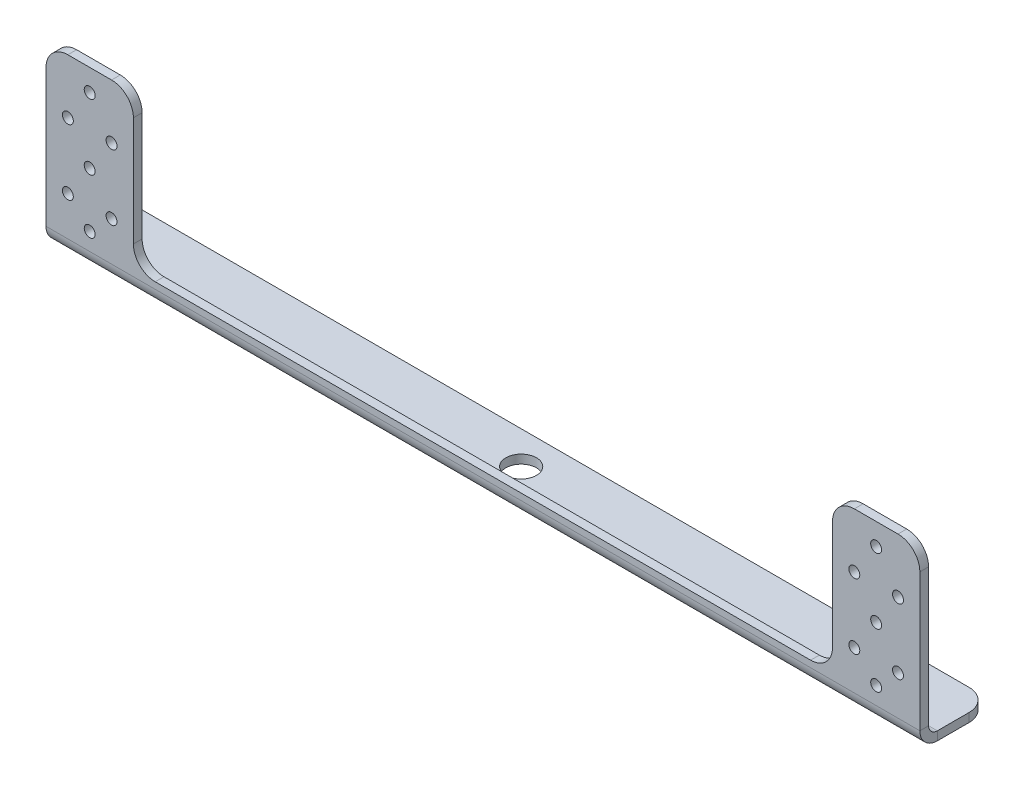
from build123d import *

# Parameters (mm, degrees)
BRIDA_BASE1_DEPTH             = 4
PLIEGUE_START                 = -21.07192
PLIEGUE_CROQUIZADO1_OUTLINE_W = 400
PLIEGUE_CROQUIZADO1_OUTLINE_H = 4
PLIEGUE_CROQUIZADO1_DEPTH     = 73.82192
PLIEGUE_START_2               = -24.25
PLIEGUE_CROQUIZADO1_2_DEPTH   = 0.02192
PLIEGUE_START_3               = -28.25
PLIEGUE_CROQUIZADO1_3_DEPTH   = 8
PLIEGUE_START_4               = -200
PLIEGUE_CROQUIZADO1_4_DEPTH   = 400
CROQUIS8_R                    = 7
CORTAR_EXTRUIR2_DEPTH         = 10
CORTAR_EXTRUIR3_REACH         = 218.197
CROQUIS9_R                    = 2.5


with BuildPart() as part:
    # Brida base1: sheet metal written as solids
    # Croquis1 → Brida base1 (new body)
    with BuildSketch(Plane(origin=(0, 0, 0), x_dir=(1, 0, 0), z_dir=(0, 1, 0))):
        with BuildLine():
            Line((170, -52.75), (190, -52.75))
            ThreePointArc((190, -52.75), (197.071067812, -49.821067812), (200, -42.75))
            Line((200, -42.75), (200, 42.75))
            ThreePointArc((200, 42.75), (197.071067812, 49.821067812), (190, 52.75))
            Line((190, 52.75), (-190, 52.75))
            ThreePointArc((-190, 52.75), (-197.071067812, 49.821067812), (-200, 42.75))
            Line((-200, 42.75), (-200, -42.75))
            ThreePointArc((-200, -42.75), (-197.071067812, -49.821067812), (-190, -52.75))
            Line((-190, -52.75), (-170, -52.75))
            ThreePointArc((-170, -52.75), (-162.928932188, -49.821067812), (-160, -42.75))
            Line((-160, -42.75), (-160, 7.25))
            ThreePointArc((-160, 7.25), (-157.071067812, 14.321067812), (-150, 17.25))
            Line((-150, 17.25), (150, 17.25))
            ThreePointArc((150, 17.25), (157.071067812, 14.321067812), (160, 7.25))
            Line((160, 7.25), (160, -42.75))
            ThreePointArc((160, -42.75), (162.928932188, -49.821067812), (170, -52.75))
        make_face()
    extrude(amount=-BRIDA_BASE1_DEPTH)

    # Pliegue croquizado1: read off the stored shape, not the designer's step
    # Pliegue croquizado1 outline → Pliegue croquizado1 (cut)
    with BuildSketch(Plane.XY.offset(PLIEGUE_START)):
        with Locations((0, -2)):
            Rectangle(PLIEGUE_CROQUIZADO1_OUTLINE_W, PLIEGUE_CROQUIZADO1_OUTLINE_H)
    extrude(amount=PLIEGUE_CROQUIZADO1_DEPTH, mode=Mode.SUBTRACT)

    # Pliegue croquizado1 2 outline → Pliegue croquizado1 2 (add)
    with BuildSketch(Plane.XY.offset(PLIEGUE_START_2)):
        with BuildLine():
            ThreePointArc((-190, 76.999999998), (-197.071067812, 74.07106781), (-200, 66.999999998))
            Line((-200, 66.999999998), (-200, 0))
            Line((-200, 0), (200, 0))
            Line((200, 0), (200, 66.999999998))
            ThreePointArc((200, 66.999999998), (197.071067812, 74.07106781), (190, 76.999999998))
            Line((190, 76.999999998), (170, 76.999999998))
            ThreePointArc((170, 76.999999998), (162.928932188, 74.07106781), (160, 66.999999998))
            Line((160, 66.999999998), (160, 16.999999998))
            ThreePointArc((160, 16.999999998), (157.071067812, 9.928932186), (150, 6.999999998))
            Line((150, 6.999999998), (-150, 6.999999998))
            ThreePointArc((-150, 6.999999998), (-157.071067812, 9.928932186), (-160, 16.999999998))
            Line((-160, 16.999999998), (-160, 66.999999998))
            ThreePointArc((-160, 66.999999998), (-162.928932188, 74.07106781), (-170, 76.999999998))
            Line((-170, 76.999999998), (-190, 76.999999998))
        make_face()
    extrude(amount=PLIEGUE_CROQUIZADO1_2_DEPTH)

    # Pliegue croquizado1 3 outline → Pliegue croquizado1 3 (add)
    with BuildSketch(Plane.XY.offset(PLIEGUE_START_3)):
        with BuildLine():
            ThreePointArc((-190, 76.999999998), (-197.071067812, 74.07106781), (-200, 66.999999998))
            Line((-200, 66.999999998), (-200, 0))
            Line((-200, 0), (200, 0))
            Line((200, 0), (200, 66.999999998))
            ThreePointArc((200, 66.999999998), (197.071067812, 74.07106781), (190, 76.999999998))
            Line((190, 76.999999998), (170, 76.999999998))
            ThreePointArc((170, 76.999999998), (162.928932188, 74.07106781), (160, 66.999999998))
            Line((160, 66.999999998), (160, 16.999999998))
            ThreePointArc((160, 16.999999998), (157.071067812, 9.928932186), (150, 6.999999998))
            Line((150, 6.999999998), (-150, 6.999999998))
            ThreePointArc((-150, 6.999999998), (-157.071067812, 9.928932186), (-160, 16.999999998))
            Line((-160, 16.999999998), (-160, 66.999999998))
            ThreePointArc((-160, 66.999999998), (-162.928932188, 74.07106781), (-170, 76.999999998))
            Line((-170, 76.999999998), (-190, 76.999999998))
        make_face()
    extrude(amount=PLIEGUE_CROQUIZADO1_3_DEPTH)

    # Pliegue croquizado1 4 outline → Pliegue croquizado1 4 (cut)
    with BuildSketch(Plane.YZ.offset(PLIEGUE_START_4)):
        with BuildLine():
            ThreePointArc((-4, -28.25), (-1.656854249, -22.593145751), (4, -20.25))
            Line((4, -20.25), (0, -20.25))
            Line((0, -20.25), (0, -21.07192))
            Line((0, -21.07192), (-4, -21.07192))
            Line((-4, -21.07192), (-4, -28.25))
        make_face()
        with BuildLine():
            ThreePointArc((4, -24.25), (1.171572875, -25.421572875), (0, -28.25))
            Line((0, -28.25), (76.999999998, -28.25))
            Line((76.999999998, -28.25), (76.999999998, -24.25))
            Line((76.999999998, -24.25), (4, -24.25))
        make_face()
    extrude(amount=PLIEGUE_CROQUIZADO1_4_DEPTH, mode=Mode.SUBTRACT)

    # Croquis8 → Cortar-Extruir2 (cut)
    with BuildSketch(Plane(origin=(0, 0, 0), x_dir=(1, 0, 0), z_dir=(0, 1, 0))):
        with Locations(Location((0, 37.75, 0), (0, 0, 270))):
            Circle(CROQUIS8_R)
    extrude(amount=-CORTAR_EXTRUIR2_DEPTH, mode=Mode.SUBTRACT)

    # Croquis9 → Cortar-Extruir3 (cut, up to next)
    with BuildSketch(Plane(origin=(0, 0, -24.25), x_dir=(-1, 0, 0), z_dir=(0, 0, -1)), mode=Mode.PRIVATE) as cortar_extruir3_sk1:
        with Locations(Location((180, 11.999999998, 0), (0, 0, 90))):
            Circle(CROQUIS9_R)
    cortar_extruir3_tool1 = extrude(cortar_extruir3_sk1.sketch, amount=-CORTAR_EXTRUIR3_REACH, mode=Mode.PRIVATE) & part.part
    # Croquis9 → Cortar-Extruir3 (cut, up to next)
    with BuildSketch(Plane(origin=(0, 0, -24.25), x_dir=(-1, 0, 0), z_dir=(0, 0, -1)), mode=Mode.PRIVATE) as cortar_extruir3_sk2:
        with Locations(Location((180, 66.999999998, 0), (0, 0, 90))):
            Circle(CROQUIS9_R)
    cortar_extruir3_tool2 = extrude(cortar_extruir3_sk2.sketch, amount=-CORTAR_EXTRUIR3_REACH, mode=Mode.PRIVATE) & part.part
    # Croquis9 → Cortar-Extruir3 (cut, up to next)
    with BuildSketch(Plane(origin=(0, 0, -24.25), x_dir=(-1, 0, 0), z_dir=(0, 0, -1)), mode=Mode.PRIVATE) as cortar_extruir3_sk3:
        with Locations(Location((170, 51.999999998, 0), (0, 0, 90))):
            Circle(CROQUIS9_R)
    cortar_extruir3_tool3 = extrude(cortar_extruir3_sk3.sketch, amount=-CORTAR_EXTRUIR3_REACH, mode=Mode.PRIVATE) & part.part
    # Croquis9 → Cortar-Extruir3 (cut, up to next)
    with BuildSketch(Plane(origin=(0, 0, -24.25), x_dir=(-1, 0, 0), z_dir=(0, 0, -1)), mode=Mode.PRIVATE) as cortar_extruir3_sk4:
        with Locations(Location((190, 51.999999998, 0), (0, 0, 90))):
            Circle(CROQUIS9_R)
    cortar_extruir3_tool4 = extrude(cortar_extruir3_sk4.sketch, amount=-CORTAR_EXTRUIR3_REACH, mode=Mode.PRIVATE) & part.part
    # Croquis9 → Cortar-Extruir3 (cut, up to next)
    with BuildSketch(Plane(origin=(0, 0, -24.25), x_dir=(-1, 0, 0), z_dir=(0, 0, -1)), mode=Mode.PRIVATE) as cortar_extruir3_sk5:
        with Locations(Location((180, 36.999999998, 0), (0, 0, 90))):
            Circle(CROQUIS9_R)
    cortar_extruir3_tool5 = extrude(cortar_extruir3_sk5.sketch, amount=-CORTAR_EXTRUIR3_REACH, mode=Mode.PRIVATE) & part.part
    # Croquis9 → Cortar-Extruir3 (cut, up to next)
    with BuildSketch(Plane(origin=(0, 0, -24.25), x_dir=(-1, 0, 0), z_dir=(0, 0, -1)), mode=Mode.PRIVATE) as cortar_extruir3_sk6:
        with Locations(Location((170, 21.999999998, 0), (0, 0, 90))):
            Circle(CROQUIS9_R)
    cortar_extruir3_tool6 = extrude(cortar_extruir3_sk6.sketch, amount=-CORTAR_EXTRUIR3_REACH, mode=Mode.PRIVATE) & part.part
    # Croquis9 → Cortar-Extruir3 (cut, up to next)
    with BuildSketch(Plane(origin=(0, 0, -24.25), x_dir=(-1, 0, 0), z_dir=(0, 0, -1)), mode=Mode.PRIVATE) as cortar_extruir3_sk7:
        with Locations(Location((190, 21.999999998, 0), (0, 0, 90))):
            Circle(CROQUIS9_R)
    cortar_extruir3_tool7 = extrude(cortar_extruir3_sk7.sketch, amount=-CORTAR_EXTRUIR3_REACH, mode=Mode.PRIVATE) & part.part
    # Croquis9 → Cortar-Extruir3 (cut, up to next)
    with BuildSketch(Plane(origin=(0, 0, -24.25), x_dir=(-1, 0, 0), z_dir=(0, 0, -1)), mode=Mode.PRIVATE) as cortar_extruir3_sk8:
        with Locations(Location((-190, 21.999999998, 0), (0, 0, 90))):
            Circle(CROQUIS9_R)
    cortar_extruir3_tool8 = extrude(cortar_extruir3_sk8.sketch, amount=-CORTAR_EXTRUIR3_REACH, mode=Mode.PRIVATE) & part.part
    # Croquis9 → Cortar-Extruir3 (cut, up to next)
    with BuildSketch(Plane(origin=(0, 0, -24.25), x_dir=(-1, 0, 0), z_dir=(0, 0, -1)), mode=Mode.PRIVATE) as cortar_extruir3_sk9:
        with Locations(Location((-170, 21.999999998, 0), (0, 0, 90))):
            Circle(CROQUIS9_R)
    cortar_extruir3_tool9 = extrude(cortar_extruir3_sk9.sketch, amount=-CORTAR_EXTRUIR3_REACH, mode=Mode.PRIVATE) & part.part
    # Croquis9 → Cortar-Extruir3 (cut, up to next)
    with BuildSketch(Plane(origin=(0, 0, -24.25), x_dir=(-1, 0, 0), z_dir=(0, 0, -1)), mode=Mode.PRIVATE) as cortar_extruir3_sk10:
        with Locations(Location((-180, 36.999999998, 0), (0, 0, 90))):
            Circle(CROQUIS9_R)
    cortar_extruir3_tool10 = extrude(cortar_extruir3_sk10.sketch, amount=-CORTAR_EXTRUIR3_REACH, mode=Mode.PRIVATE) & part.part
    # Croquis9 → Cortar-Extruir3 (cut, up to next)
    with BuildSketch(Plane(origin=(0, 0, -24.25), x_dir=(-1, 0, 0), z_dir=(0, 0, -1)), mode=Mode.PRIVATE) as cortar_extruir3_sk11:
        with Locations(Location((-190, 51.999999998, 0), (0, 0, 90))):
            Circle(CROQUIS9_R)
    cortar_extruir3_tool11 = extrude(cortar_extruir3_sk11.sketch, amount=-CORTAR_EXTRUIR3_REACH, mode=Mode.PRIVATE) & part.part
    # Croquis9 → Cortar-Extruir3 (cut, up to next)
    with BuildSketch(Plane(origin=(0, 0, -24.25), x_dir=(-1, 0, 0), z_dir=(0, 0, -1)), mode=Mode.PRIVATE) as cortar_extruir3_sk12:
        with Locations(Location((-170, 51.999999998, 0), (0, 0, 90))):
            Circle(CROQUIS9_R)
    cortar_extruir3_tool12 = extrude(cortar_extruir3_sk12.sketch, amount=-CORTAR_EXTRUIR3_REACH, mode=Mode.PRIVATE) & part.part
    # Croquis9 → Cortar-Extruir3 (cut, up to next)
    with BuildSketch(Plane(origin=(0, 0, -24.25), x_dir=(-1, 0, 0), z_dir=(0, 0, -1)), mode=Mode.PRIVATE) as cortar_extruir3_sk13:
        with Locations(Location((-180, 66.999999998, 0), (0, 0, 90))):
            Circle(CROQUIS9_R)
    cortar_extruir3_tool13 = extrude(cortar_extruir3_sk13.sketch, amount=-CORTAR_EXTRUIR3_REACH, mode=Mode.PRIVATE) & part.part
    # Croquis9 → Cortar-Extruir3 (cut, up to next)
    with BuildSketch(Plane(origin=(0, 0, -24.25), x_dir=(-1, 0, 0), z_dir=(0, 0, -1)), mode=Mode.PRIVATE) as cortar_extruir3_sk14:
        with Locations(Location((-180, 11.999999998, 0), (0, 0, 90))):
            Circle(CROQUIS9_R)
    cortar_extruir3_tool14 = extrude(cortar_extruir3_sk14.sketch, amount=-CORTAR_EXTRUIR3_REACH, mode=Mode.PRIVATE) & part.part
    add(cortar_extruir3_tool1.solids().sort_by_distance((-180, 12, -24.25))[0], mode=Mode.SUBTRACT)
    add(cortar_extruir3_tool2.solids().sort_by_distance((-180, 67, -24.25))[0], mode=Mode.SUBTRACT)
    add(cortar_extruir3_tool3.solids().sort_by_distance((-170, 52, -24.25))[0], mode=Mode.SUBTRACT)
    add(cortar_extruir3_tool4.solids().sort_by_distance((-190, 52, -24.25))[0], mode=Mode.SUBTRACT)
    add(cortar_extruir3_tool5.solids().sort_by_distance((-180, 37, -24.25))[0], mode=Mode.SUBTRACT)
    add(cortar_extruir3_tool6.solids().sort_by_distance((-170, 22, -24.25))[0], mode=Mode.SUBTRACT)
    add(cortar_extruir3_tool7.solids().sort_by_distance((-190, 22, -24.25))[0], mode=Mode.SUBTRACT)
    add(cortar_extruir3_tool8.solids().sort_by_distance((190, 22, -24.25))[0], mode=Mode.SUBTRACT)
    add(cortar_extruir3_tool9.solids().sort_by_distance((170, 22, -24.25))[0], mode=Mode.SUBTRACT)
    add(cortar_extruir3_tool10.solids().sort_by_distance((180, 37, -24.25))[0], mode=Mode.SUBTRACT)
    add(cortar_extruir3_tool11.solids().sort_by_distance((190, 52, -24.25))[0], mode=Mode.SUBTRACT)
    add(cortar_extruir3_tool12.solids().sort_by_distance((170, 52, -24.25))[0], mode=Mode.SUBTRACT)
    add(cortar_extruir3_tool13.solids().sort_by_distance((180, 67, -24.25))[0], mode=Mode.SUBTRACT)
    add(cortar_extruir3_tool14.solids().sort_by_distance((180, 12, -24.25))[0], mode=Mode.SUBTRACT)


solid = part.part
